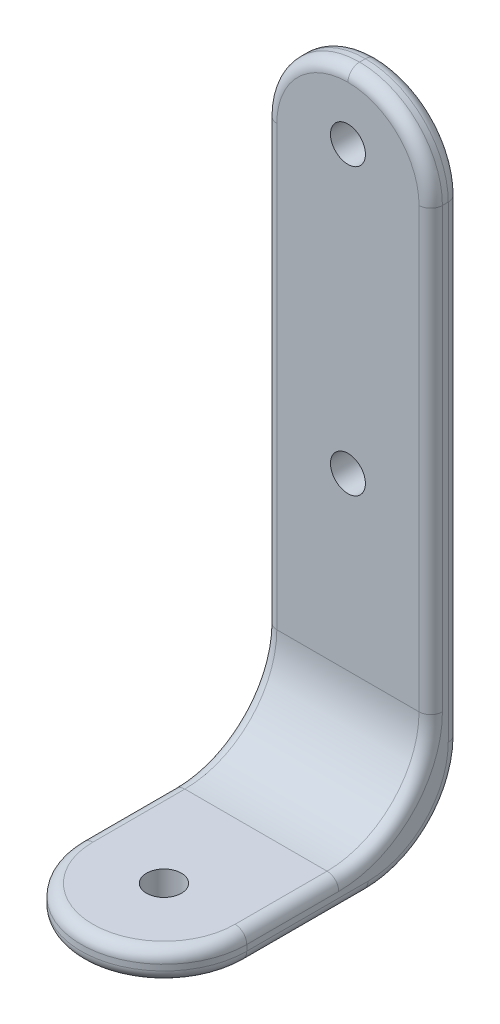
from build123d import *

# Parameters (mm, degrees)
SKETCH1_W             = 18
SKETCH1_H             = 3.175
BASE_DEPTH            = 3.175
SKETCH1_3_W           = 18
SKETCH1_3_H           = 3.175
RISER_DEPTH           = 66.675
F_6_CLEARANCE_HOLE2_D = 3.7973
F_6_CLEARANCE_HOLE1_D = 3.7973
FILLET1_R             = 10
FILLET2_R             = 9
FILLET3_R             = 10
FILLET4_R             = 1.27


with BuildPart() as part:
    # Sketch1 → Base (new body)
    with BuildSketch(Plane(origin=(0, 0, 0), x_dir=(1, 0, 0), z_dir=(0, 1, 0))):
        with BuildLine():
            Line((-9, 0), (-9, 20))
            Line((-9, 20), (9, 20))
            Line((9, 20), (9, 0))
            ThreePointArc((9, 0), (0, -9), (-9, 0))
        make_face()
        with Locations((0, 21.5875)):
            Rectangle(SKETCH1_W, SKETCH1_H)
    extrude(amount=-BASE_DEPTH)

    # Sketch1<3> → Riser (add)
    with BuildSketch(Plane(origin=(0, 0, 0), x_dir=(1, 0, 0), z_dir=(0, 1, 0))):
        with Locations((0, 21.5875)):
            Rectangle(SKETCH1_3_W, SKETCH1_3_H)
    extrude(amount=RISER_DEPTH)

    # #6 Clearance Hole2 (through all)
    with Locations(Plane(origin=(0, 0, 0), x_dir=(-1, 0, 0), z_dir=(0, 1, 0))):
        with Locations((0, 0)):
            Hole(F_6_CLEARANCE_HOLE2_D / 2)

    # #6 Clearance Hole1 (through all)
    with Locations(Plane.XY.offset(-20)):
        with Locations((0, 59.575), (0, 28.575)):
            Hole(F_6_CLEARANCE_HOLE1_D / 2)

    # Fillet1
    fillet1_edges = [part.edges().sort_by_distance(p)[0] for p in [
        (0, 0, -20),
    ]]
    fillet(fillet1_edges, radius=FILLET1_R)

    # Fillet2
    fillet2_edges = [part.edges().sort_by_distance(p)[0] for p in [
        (-9, 66.675, -21.5875),
        (9, 66.675, -21.5875),
    ]]
    fillet(fillet2_edges, radius=FILLET2_R - 0.0001)  # a hair under: the kernel refuses the full size

    # Fillet3
    fillet3_edges = [part.edges().sort_by_distance(p)[0] for p in [
        (0, -3.175, -23.175),
    ]]
    fillet(fillet3_edges, radius=FILLET3_R)

    # Fillet4
    fillet4_edges = [part.edges().sort_by_distance(p)[0] for p in [
        (0, -3.175, 9),
        (9, -3.175, -6.5875),
        (-9, -3.175, -6.5875),
        (9, 2.928932188, -17.071067812),
        (-9, 2.928932188, -17.071067812),
        (-9, 33.83755, -20),
        (6.36399032, 64.03899032, -23.175),
        (-6.36399032, 64.03899032, -23.175),
        (9, 33.83755, -20),
        (6.36399032, 64.03899032, -20),
        (-6.36399032, 64.03899032, -20),
        (9, 0, -5),
        (9, 32.25005, -23.175),
        (9, -0.246067812, -20.246067812),
        (-9, 32.25005, -23.175),
        (-9, -0.246067812, -20.246067812),
        (0, 0, 9),
        (-9, 0, -5),
    ]]
    fillet(fillet4_edges, radius=FILLET4_R)


solid = part.part
